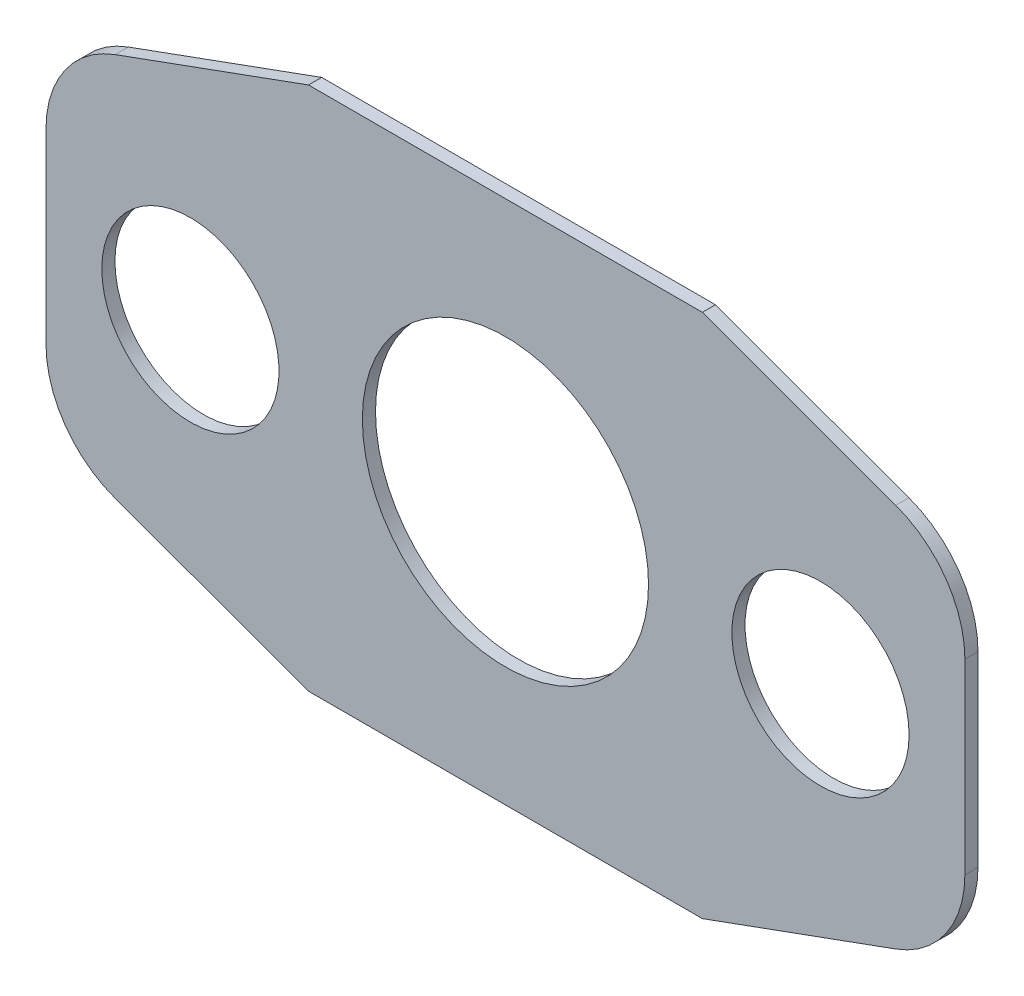
from build123d import *

# Parameters (mm, degrees)
SKETCH1_R           = 10.9
SKETCH1_R_2         = 6.75
BOSS_EXTRUDE1_DEPTH = 1


with BuildPart() as part:
    # Sketch1 → Boss-Extrude1 (new body)
    with BuildSketch(Plane.XY):
        with BuildLine():
            Line((-15, 20), (15, 20))
            Line((15, 20), (29.736161147, 14.636475975))
            ThreePointArc((29.736161147, 14.636475975), (33.553216354, 11.7075465), (35, 7.118935009))
            Line((35, 7.118935009), (35, -7.118935009))
            ThreePointArc((35, -7.118935009), (33.553216354, -11.7075465), (29.736161147, -14.636475975))
            Line((29.736161147, -14.636475975), (15, -20))
            Line((15, -20), (-15, -20))
            Line((-15, -20), (-29.736161147, -14.636475975))
            ThreePointArc((-29.736161147, -14.636475975), (-33.553216354, -11.7075465), (-35, -7.118935009))
            Line((-35, -7.118935009), (-35, 7.118935009))
            ThreePointArc((-35, 7.118935009), (-33.553216354, 11.7075465), (-29.736161147, 14.636475975))
            Line((-29.736161147, 14.636475975), (-15, 20))
        make_face()
        Circle(SKETCH1_R, mode=Mode.SUBTRACT)
        with Locations((24, 0)):
            Circle(SKETCH1_R_2, mode=Mode.SUBTRACT)
        with Locations((-24, 0)):
            Circle(SKETCH1_R_2, mode=Mode.SUBTRACT)
    extrude(amount=-BOSS_EXTRUDE1_DEPTH)


solid = part.part
